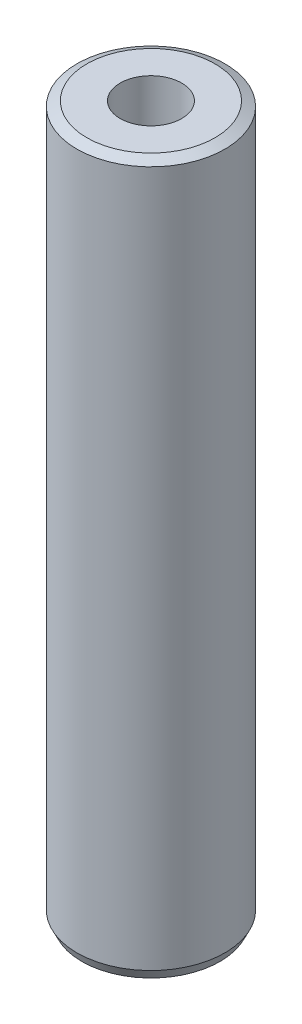
from build123d import *
from OCP.BRepFilletAPI import BRepFilletAPI_MakeChamfer

# Parameters (mm, degrees)
SKETCH1_R           = 45
BOSS_EXTRUDE1_DEPTH = 432.185531785
SKETCH2_R           = 18.711322059
CUT_EXTRUDE1_DEPTH  = 437.845892603
CHAMFER1_SIZE       = 2.97003702
CHAMFER1_SIZE2      = 6.041897764


with BuildPart() as part:
    # Sketch1 → Boss-Extrude1 (new body)
    with BuildSketch(Plane(origin=(0, 0, 0), x_dir=(1, 0, 0), z_dir=(0, 1, 0))):
        Circle(SKETCH1_R)
    extrude(amount=BOSS_EXTRUDE1_DEPTH)

    # Sketch2 → Cut-Extrude1 (cut, through all)
    with BuildSketch(Plane(origin=(0, 0, 0), x_dir=(1, 0, 0), z_dir=(0, 1, 0))):
        Circle(SKETCH2_R)
    extrude(amount=CUT_EXTRUDE1_DEPTH, mode=Mode.SUBTRACT)

    # Chamfer1: one chamfer whose edges measure the first distance from different faces: ONE call of the kernel's chamfer builder (chamfer() names one face for all edges)
    chamfer1_edges_1 = [part.edges().sort_by_distance(p)[0] for p in [
        (-45, 432.185531785, 0),
    ]]
    chamfer1_side_1 = [part.faces().sort_by_distance(p)[0] for p in [
        (-45, 216.092765893, 0),
    ]]
    chamfer1_edges_2 = [part.edges().sort_by_distance(p)[0] for p in [
        (-45, 0, 0),
    ]]
    chamfer1_side_2 = [part.faces().sort_by_distance(p)[0] for p in [
        (-43.727207794, 0, 0),
    ]]
    chamfer1 = BRepFilletAPI_MakeChamfer(part.part.solid().wrapped)
    for e in chamfer1_edges_1:
        chamfer1.Add(CHAMFER1_SIZE, CHAMFER1_SIZE2, e.wrapped, chamfer1_side_1[0].wrapped)  # the first distance lies on this face
    for e in chamfer1_edges_2:
        chamfer1.Add(CHAMFER1_SIZE, CHAMFER1_SIZE2, e.wrapped, chamfer1_side_2[0].wrapped)  # the first distance lies on this face
    add(Compound.cast(chamfer1.Shape()), mode=Mode.REPLACE)


solid = part.part
